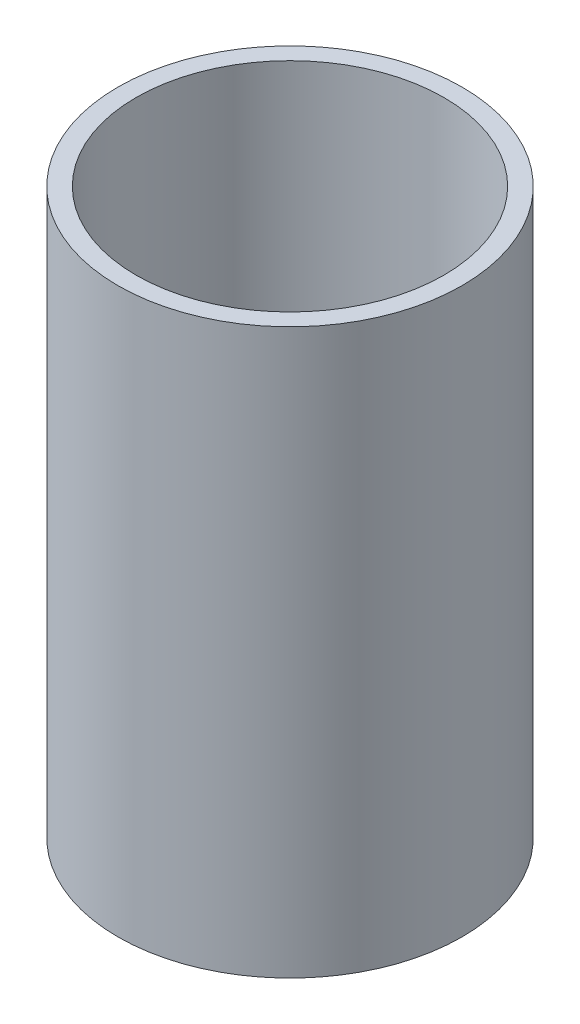
from build123d import *

# Parameters (mm, degrees)
SKETCH1_R           = 30.1625
SKETCH1_R_2         = 26.9875
BOSS_EXTRUDE1_DEPTH = 98.9


with BuildPart() as part:
    # Sketch1 → Boss-Extrude1 (new body)
    with BuildSketch(Plane(origin=(0, 0, 0), x_dir=(1, 0, 0), z_dir=(0, 1, 0))):
        Circle(SKETCH1_R)
        Circle(SKETCH1_R_2, mode=Mode.SUBTRACT)
    extrude(amount=BOSS_EXTRUDE1_DEPTH)


solid = part.part
